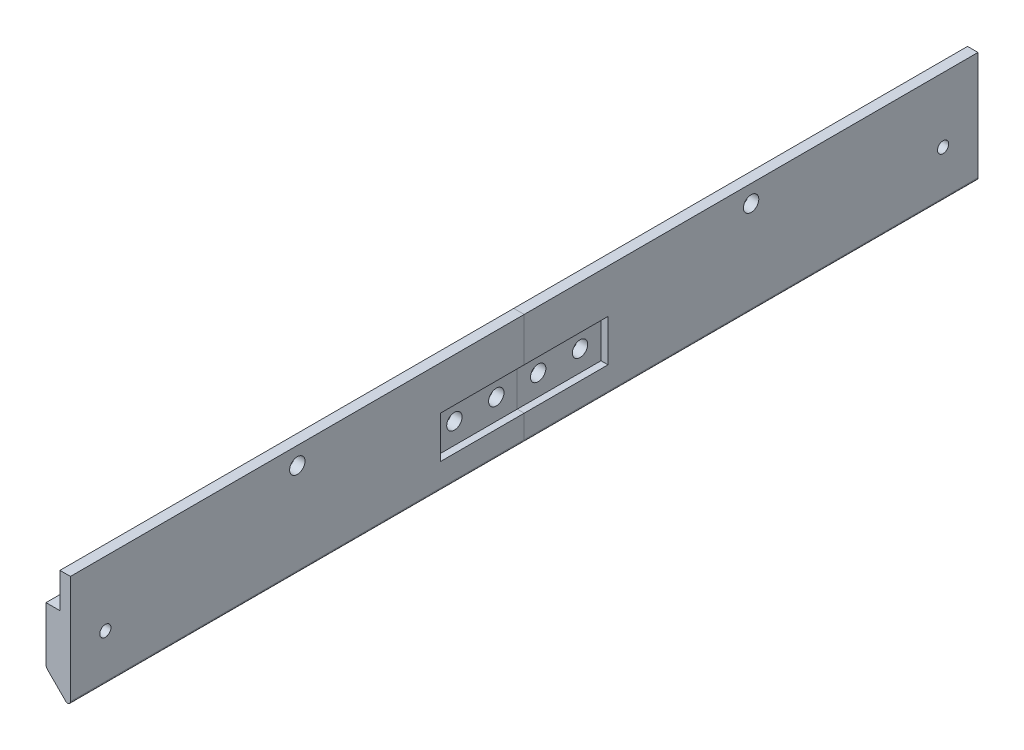
from build123d import *

# Parameters (mm, degrees)
BOSS_EXTRUDE1_DEPTH                = 260
FILLET1_R                          = 1.5
SKETCH2_W                          = 20
SKETCH2_H                          = 260
CUT_EXTRUDE1_DEPTH                 = 10
FILLET2_R                          = 0.8
SKETCH4_W                          = 3
SKETCH4_H                          = 260
BOSS_EXTRUDE2_DEPTH                = 10
SKETCH3_W                          = 260
SKETCH3_H                          = 13
BOSS_EXTRUDE3_DEPTH                = 4
CSK_FOR_M3_SFHCS1_D                = 3.2
CSK_FOR_M3_SFHCS1_CSINK_D          = 6.72
CSK_FOR_M3_SFHCS1_CSINK_ANGLE      = 90
SPLIT1_SURFACE_1_BACK              = 263.039
SPLIT1_SURFACE_1_DEPTH             = 526.078
SPLIT1_SURFACE_2_BACK              = 263.039
SPLIT1_SURFACE_2_DEPTH             = 526.078
F_4_4_START                        = -3
F_4_4_4_4_DIAMETER_HOLE1_OUTLINE_R = 2.2
F_4_4_4_4_DIAMETER_HOLE1_DEPTH     = 3
SKETCH12_W                         = 48
SKETCH12_H                         = 12
CUT_EXTRUDE2_DEPTH                 = 2
F_4_4_START_2                      = -5
F_4_4_4_4_DIAMETER_HOLE2_OUTLINE_R = 2.2
F_4_4_4_4_DIAMETER_HOLE2_DEPTH     = 3


# Read off the part's stored shape, not the designer's step: Ø4.4 (4.4) Diameter Hole1, Ø4.4 (4.4) Diameter Hole2
with BuildPart() as part:
    # Sketch1 → Boss-Extrude1 (new body)
    with BuildSketch(Plane.XY.offset(280)):
        Polygon((-7, 4), (4, -7), (7, -7), (7, -3), (20, -3), (20, 0), (0, 0), (0, 20), (-3, 20), (-3, 7), (-7, 7), align=None)
    extrude(amount=-BOSS_EXTRUDE1_DEPTH)

    # Fillet1
    fillet1_edges = [part.edges().sort_by_distance(p)[0] for p in [
        (4, -7, 150),
        (-7, 4, 150),
    ]]
    fillet(fillet1_edges, radius=FILLET1_R)

    # Sketch2 → Cut-Extrude1 (cut)
    with BuildSketch(Plane(origin=(0, 0, 0), x_dir=(1, 0, 0), z_dir=(0, 1, 0))):
        with Locations((10, -150)):
            Rectangle(SKETCH2_W, SKETCH2_H)
    extrude(amount=-CUT_EXTRUDE1_DEPTH, mode=Mode.SUBTRACT)

    # Fillet2
    fillet2_edges = [part.edges().sort_by_distance(p)[0] for p in [
        (0, -3, 150),
    ]]
    fillet(fillet2_edges, radius=FILLET2_R)

    # Sketch4 → Boss-Extrude2 (add)
    with BuildSketch(Plane(origin=(0, 20, 0), x_dir=(1, 0, 0), z_dir=(0, 1, 0))):
        with Locations((-1.5, -150)):
            Rectangle(SKETCH4_W, SKETCH4_H)
    extrude(amount=BOSS_EXTRUDE2_DEPTH)

    # Sketch3 → Boss-Extrude3 (add)
    with BuildSketch(Plane.ZY.offset(3)):
        with Locations((150, 13.5)):
            Rectangle(SKETCH3_W, SKETCH3_H)
    extrude(amount=BOSS_EXTRUDE3_DEPTH)

    # CSK for M3 SFHCS1 (through all)
    with Locations(Plane.ZY.offset(7)):
        with Locations((30, 11.5), (270, 11.5)):
            CounterSinkHole(CSK_FOR_M3_SFHCS1_D / 2, CSK_FOR_M3_SFHCS1_CSINK_D / 2, counter_sink_angle=CSK_FOR_M3_SFHCS1_CSINK_ANGLE)


with BuildPart() as body_2:
    # Split1: the piece behind the surface
    add(part.part)
    # Split1 surface: a surface, the sketch's curves swept straight by 526.078 mm
    with BuildLine(Plane(origin=(0, 0, 0), x_dir=(0, 0, -1), z_dir=(1, 0, 0)).offset(-SPLIT1_SURFACE_1_BACK), mode=Mode.PRIVATE) as split1_surface_1_path:
        Line((-150, 30), (-150, -1.86862915))
    split1_surface_1 = Shell.extrude(split1_surface_1_path.wire(), (1 * SPLIT1_SURFACE_1_DEPTH, 0 * SPLIT1_SURFACE_1_DEPTH, 0 * SPLIT1_SURFACE_1_DEPTH))
    split(bisect_by=split1_surface_1, keep=Keep.BOTTOM)


with BuildPart() as part_1:
    add(part.part)

    # Split1: split by a surface, the side it looks to stays
    # Split1 surface: a surface, the sketch's curves swept straight by 526.078 mm
    with BuildLine(Plane(origin=(0, 0, 0), x_dir=(0, 0, -1), z_dir=(1, 0, 0)).offset(-SPLIT1_SURFACE_2_BACK), mode=Mode.PRIVATE) as split1_surface_2_path:
        Line((-150, 30), (-150, -1.86862915))
    split1_surface_2 = Shell.extrude(split1_surface_2_path.wire(), (1 * SPLIT1_SURFACE_2_DEPTH, 0 * SPLIT1_SURFACE_2_DEPTH, 0 * SPLIT1_SURFACE_2_DEPTH))
    split(bisect_by=split1_surface_2, keep=Keep.TOP)


with BuildPart() as f_4_4_4_4_diameter_hole1_tool:
    # Ø4.4 (4.4) Diameter Hole1 outline → Ø4.4 (4.4) Diameter Hole1 (new body)
    with BuildSketch(Plane.YZ.offset(F_4_4_START)):
        with Locations((25, 85)):
            Circle(F_4_4_4_4_DIAMETER_HOLE1_OUTLINE_R)
        with Locations((25, 215)):
            Circle(F_4_4_4_4_DIAMETER_HOLE1_OUTLINE_R)
    extrude(amount=F_4_4_4_4_DIAMETER_HOLE1_DEPTH)


with BuildPart() as part_2:
    add(part_1.part)

    # Ø4.4 (4.4) Diameter Hole1: cut by f_4_4_4_4_diameter_hole1_tool
    add(f_4_4_4_4_diameter_hole1_tool.part, mode=Mode.SUBTRACT)


with BuildPart() as body_2_1:
    add(body_2.part)

    # Ø4.4 (4.4) Diameter Hole1: cut by f_4_4_4_4_diameter_hole1_tool
    add(f_4_4_4_4_diameter_hole1_tool.part, mode=Mode.SUBTRACT)


with BuildPart() as cut_extrude2_tool:
    # Sketch12 → Cut-Extrude2 (new body)
    with BuildSketch(Plane(origin=(0, 0, 0), x_dir=(0, 0, -1), z_dir=(1, 0, 0))):
        with Locations((-150, 11.5)):
            Rectangle(SKETCH12_W, SKETCH12_H)
    extrude(amount=-CUT_EXTRUDE2_DEPTH)


with BuildPart() as part_3:
    add(part_2.part)

    # Cut-Extrude2: cut by cut_extrude2_tool
    add(cut_extrude2_tool.part, mode=Mode.SUBTRACT)


with BuildPart() as body_2_2:
    add(body_2_1.part)

    # Cut-Extrude2: cut by cut_extrude2_tool
    add(cut_extrude2_tool.part, mode=Mode.SUBTRACT)


with BuildPart() as f_4_4_4_4_diameter_hole2_tool:
    # Ø4.4 (4.4) Diameter Hole2 outline → Ø4.4 (4.4) Diameter Hole2 (new body)
    with BuildSketch(Plane.YZ.offset(F_4_4_START_2)):
        with Locations((11.5, 132)):
            Circle(F_4_4_4_4_DIAMETER_HOLE2_OUTLINE_R)
        with Locations((11.5, 144)):
            Circle(F_4_4_4_4_DIAMETER_HOLE2_OUTLINE_R)
        with Locations((11.5, 168)):
            Circle(F_4_4_4_4_DIAMETER_HOLE2_OUTLINE_R)
        with Locations((11.5, 156)):
            Circle(F_4_4_4_4_DIAMETER_HOLE2_OUTLINE_R)
    extrude(amount=F_4_4_4_4_DIAMETER_HOLE2_DEPTH)


with BuildPart() as part_4:
    add(part_3.part)

    # Ø4.4 (4.4) Diameter Hole2: cut by f_4_4_4_4_diameter_hole2_tool
    add(f_4_4_4_4_diameter_hole2_tool.part, mode=Mode.SUBTRACT)


with BuildPart() as body_2_3:
    add(body_2_2.part)

    # Ø4.4 (4.4) Diameter Hole2: cut by f_4_4_4_4_diameter_hole2_tool
    add(f_4_4_4_4_diameter_hole2_tool.part, mode=Mode.SUBTRACT)


solid = Compound([part_4.part, body_2_3.part])
